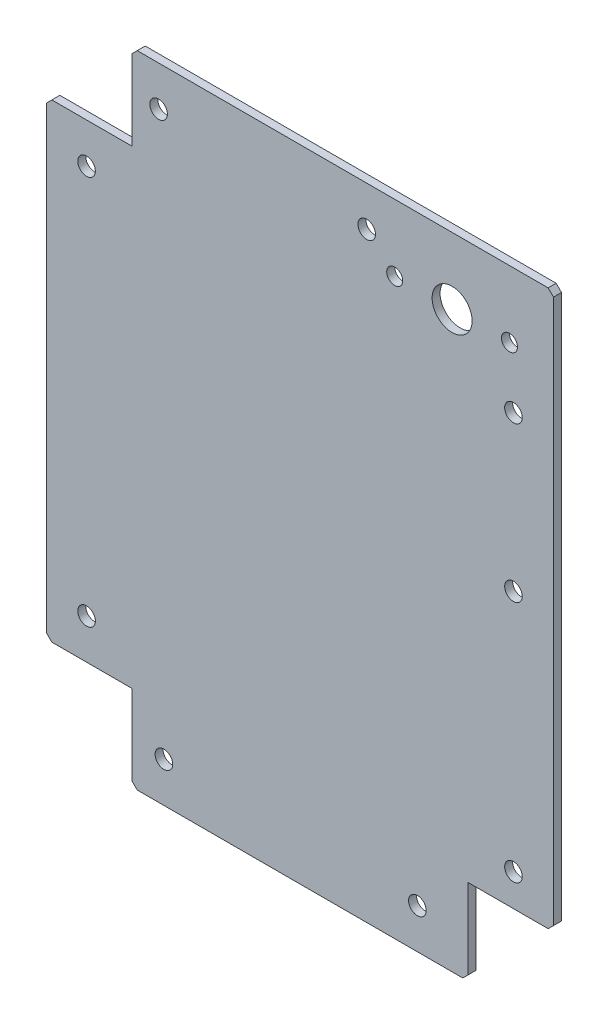
from build123d import *

# Parameters (mm, degrees)
BASE_FLANGE1_DEPTH = 3
CHAMFER1_SIZE      = 2
SKETCH3_R          = 3
CUT_EXTRUDE1_DEPTH = 10
SKETCH4_R          = 3.3
SKETCH4_R_2        = 7.5
CUT_EXTRUDE2_DEPTH = 10


# Sheet-metal steps are written as plain solids
with BuildPart() as part:
    # Sketch1 → Base-Flange1 (new body)
    with BuildSketch(Plane.XY):
        Polygon((0, 208), (32, 208), (32, 240), (190, 240), (190, 32), (158, 32), (158, 0), (32, 0), (32, 32), (0, 32), align=None)
    extrude(amount=-BASE_FLANGE1_DEPTH)

    # Chamfer1
    chamfer1_edges = [part.edges().sort_by_distance(p)[0] for p in [
        (190, 32, -1.5),
        (158, 0, -1.5),
        (32, 0, -1.5),
        (0, 32, -1.5),
        (0, 208, -1.5),
        (32, 240, -1.5),
        (190, 240, -1.5),
    ]]
    chamfer(chamfer1_edges, length=CHAMFER1_SIZE)

    # Sketch3 → Cut-Extrude1 (cut)
    with BuildSketch(Plane.XY):
        with Locations((130.5, 215)):
            Circle(SKETCH3_R)
        with Locations((173.5, 215)):
            Circle(SKETCH3_R)
    extrude(amount=-CUT_EXTRUDE1_DEPTH, mode=Mode.SUBTRACT)

    # Sketch4 → Cut-Extrude2 (cut)
    with BuildSketch(Plane.XY):
        with Locations((42, 225)):
            Circle(SKETCH4_R)
        with Locations((120, 225)):
            Circle(SKETCH4_R)
        with Locations((175, 193)):
            Circle(SKETCH4_R)
        with Locations((175, 135)):
            Circle(SKETCH4_R)
        with Locations((175, 44)):
            Circle(SKETCH4_R)
        with Locations((139, 15)):
            Circle(SKETCH4_R)
        with Locations((44, 15)):
            Circle(SKETCH4_R)
        with Locations((15, 193)):
            Circle(SKETCH4_R)
        with Locations((15, 47)):
            Circle(SKETCH4_R)
        with Locations((152, 215)):
            Circle(SKETCH4_R_2)
    extrude(amount=-CUT_EXTRUDE2_DEPTH, mode=Mode.SUBTRACT)


solid = part.part
